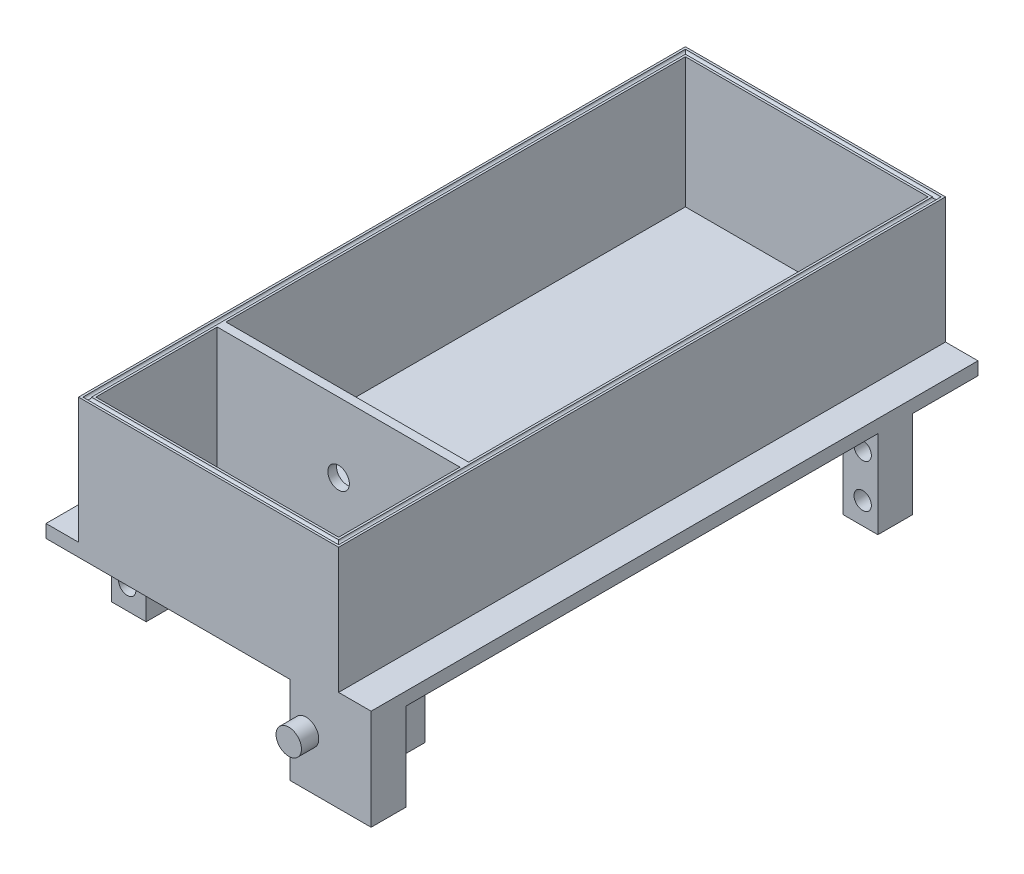
from build123d import *

# Parameters (mm, degrees)
SKETCH1_W            = 60
SKETCH1_H            = 110
BOSS_EXTRUDE1_DEPTH  = 2
SKETCH2_W            = 60
SKETCH2_H            = 110
SKETCH2_W_2          = 56
SKETCH2_H_2          = 106
BOSS_EXTRUDE2_DEPTH  = 30
SKETCH3_W            = 60
SKETCH3_H            = 30
BOSS_EXTRUDE3_DEPTH  = 2
BOSS_EXTRUDE4_DEPTH  = 30
SKETCH5_R            = 2.486759959
CUT_EXTRUDE1_DEPTH   = 30
CUT_SWEEP1_PROFILE_R = 0.5
SKETCH43_W           = 7.5
SKETCH43_H           = 140
BOSS_EXTRUDE7_DEPTH  = 3
SKETCH55_W           = 8
SKETCH55_H           = 8
BOSS_EXTRUDE10_DEPTH = 20.2
SKETCH56_R           = 2
CUT_EXTRUDE3_DEPTH   = 46.2
SKETCH59_R           = 2
CUT_EXTRUDE4_DEPTH   = 49.2
SKETCH60_R           = 2.925
BOSS_EXTRUDE11_DEPTH = 4
SKETCH61_R           = 2.925
BOSS_EXTRUDE12_DEPTH = 4


with BuildPart() as part:
    # Sketch1 → Boss-Extrude1 (new body)
    with BuildSketch(Plane(origin=(0, 0, 0), x_dir=(1, 0, 0), z_dir=(0, 1, 0))):
        Rectangle(SKETCH1_W, SKETCH1_H)
    extrude(amount=BOSS_EXTRUDE1_DEPTH)

    # Sketch2 → Boss-Extrude2 (add)
    with BuildSketch(Plane(origin=(0, 2, 0), x_dir=(1, 0, 0), z_dir=(0, 1, 0))):
        Rectangle(SKETCH2_W, SKETCH2_H)
        Rectangle(SKETCH2_W_2, SKETCH2_H_2, mode=Mode.SUBTRACT)
    extrude(amount=BOSS_EXTRUDE2_DEPTH)

    # Sketch3 → Boss-Extrude3 (add)
    with BuildSketch(Plane(origin=(0, 0, 0), x_dir=(1, 0, 0), z_dir=(0, 1, 0))):
        with Locations((0, -70)):
            Rectangle(SKETCH3_W, SKETCH3_H)
    extrude(amount=BOSS_EXTRUDE3_DEPTH)

    # Sketch4 → Boss-Extrude4 (add)
    with BuildSketch(Plane(origin=(0, 2, 0), x_dir=(1, 0, 0), z_dir=(0, 1, 0))):
        Polygon((-28, -55), (-30, -55), (-30, -85), (30, -85), (30, -55), (28, -55), (28, -83), (-28, -83), align=None)
    extrude(amount=BOSS_EXTRUDE4_DEPTH)

    # Sketch5 → Cut-Extrude1 (cut)
    with BuildSketch(Plane.XY.offset(55)):
        with Locations((0, 15.890944925)):
            Circle(SKETCH5_R)
    extrude(amount=-CUT_EXTRUDE1_DEPTH, mode=Mode.SUBTRACT)

    # Cut-Sweep1: sweep along a path in Sketch6
    with BuildLine(Plane(origin=(0, 32, 0), x_dir=(1, 0, 0), z_dir=(0, 1, 0))) as cut_sweep1_path:
        Line((-29, 54), (-29, -84))
        Line((-29, -84), (29, -84))
        Line((29, -84), (29, 54))
        Line((29, 54), (-29, 54))
    # Cut-Sweep1 profile (on start of the path) → Cut-Sweep1 (sweep, cut)
    with BuildSketch(Plane(origin=(-29, 32, -54), x_dir=(1, 0, 0), z_dir=(0, 0, 1))):
        Circle(CUT_SWEEP1_PROFILE_R)
    sweep(path=cut_sweep1_path.line, transition=Transition.RIGHT, mode=Mode.SUBTRACT)

    # Sketch43 → Boss-Extrude7 (add)
    with BuildSketch(Plane.XZ):
        with Locations((33.75, 15)):
            Rectangle(SKETCH43_W, SKETCH43_H)
        Polygon((-30, -55), (-37.5, -55), (-37.5, 85), (-30, 85), (-30, 55), align=None)
    extrude(amount=-BOSS_EXTRUDE7_DEPTH)

    # Sketch55 → Boss-Extrude10 (add)
    with BuildSketch(Plane.XZ):
        with Locations((-33.5, 65.9)):
            Rectangle(SKETCH55_W, SKETCH55_H)
        Polygon((10.5, 69.9), (10.5, 61.9), (26.781976889, 61.9), (26.781976889, 77), (37.5, 77), (37.5, 85), (18.781976889, 85), (18.781976889, 69.9), align=None)
        with Locations((33.5, -35.9)):
            Rectangle(SKETCH55_W, SKETCH55_H)
        Polygon((-10.5, -39.9), (-10.5, -31.9), (-26.5, -31.9), (-26.5, -47), (-37.5, -47), (-37.5, -55), (-18.5, -55), (-18.5, -39.9), align=None)
    extrude(amount=BOSS_EXTRUDE10_DEPTH)

    # Sketch56 → Cut-Extrude3 (cut)
    with BuildSketch(Plane.XY.offset(85)):
        with Locations((-33.859011555, -15.1)):
            Circle(SKETCH56_R)
        with Locations((-33.859011555, -5.1)):
            Circle(SKETCH56_R)
        with Locations((15.140988445, -15.1)):
            Circle(SKETCH56_R)
        with Locations((15.140988445, -5.1)):
            Circle(SKETCH56_R)
    extrude(amount=-CUT_EXTRUDE3_DEPTH, mode=Mode.SUBTRACT)

    # Sketch59 → Cut-Extrude4 (cut)
    with BuildSketch(Plane(origin=(0, 0, -55), x_dir=(-1, 0, 0), z_dir=(0, 0, -1))):
        with Locations((-34, -15.1)):
            Circle(SKETCH59_R)
        with Locations((-34, -5.1)):
            Circle(SKETCH59_R)
        with Locations((15, -5.1)):
            Circle(SKETCH59_R)
        with Locations((15, -15.1)):
            Circle(SKETCH59_R)
    extrude(amount=-CUT_EXTRUDE4_DEPTH, mode=Mode.SUBTRACT)

    # Sketch60 → Boss-Extrude11 (add)
    with BuildSketch(Plane(origin=(0, 0, -55), x_dir=(-1, 0, 0), z_dir=(0, 0, -1))):
        with Locations((22.5, -8.6)):
            Circle(SKETCH60_R)
    extrude(amount=BOSS_EXTRUDE11_DEPTH)

    # Sketch61 → Boss-Extrude12 (add)
    with BuildSketch(Plane.XY.offset(85)):
        with Locations((22.5, -8.6)):
            Circle(SKETCH61_R)
    extrude(amount=BOSS_EXTRUDE12_DEPTH)


solid = part.part
